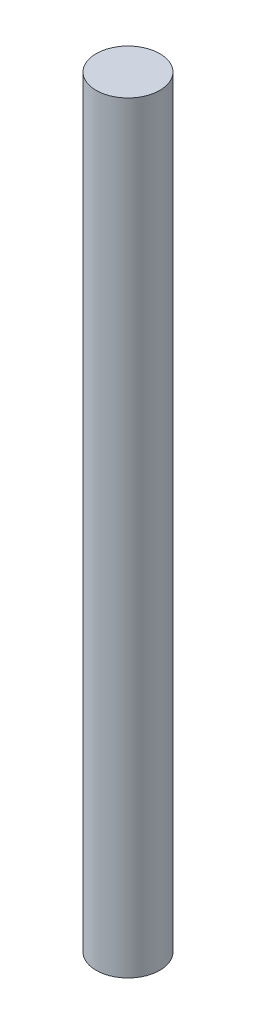
from build123d import *

# Parameters (mm, degrees)
CROQUIS5_R              = 3.175
SALIENTE_EXTRUIR2_DEPTH = 76


with BuildPart() as part:
    # Croquis5 → Saliente-Extruir2 (new body)
    with BuildSketch(Plane(origin=(0, 0, 0), x_dir=(1, 0, 0), z_dir=(0, 1, 0))):
        Circle(CROQUIS5_R)
    extrude(amount=SALIENTE_EXTRUIR2_DEPTH)


solid = part.part
